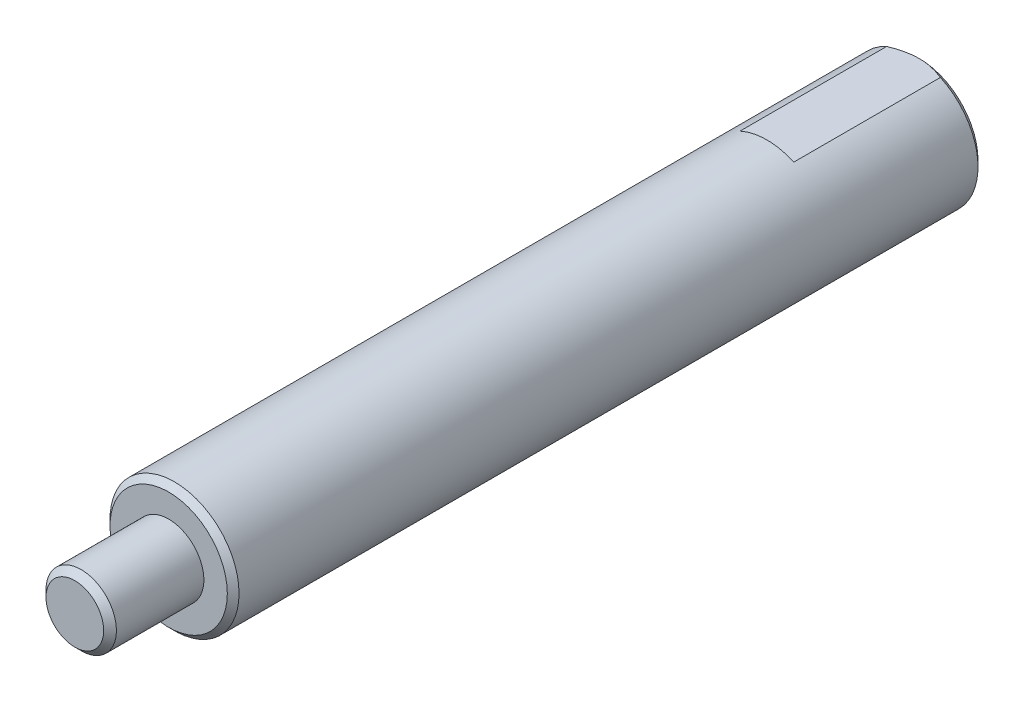
from build123d import *

# Parameters (mm, degrees)
SKETCH_1_R             = 5.5
EXTRUDE_1_DEPTH        = 64
CHAMFER_1_SIZE         = 0.5
SKETCH_2_R             = 3.3
EXTRUDE_2_DEPTH        = 8
HOLE_WIZARD_M5_1_D     = 4.2
HOLE_WIZARD_M5_1_DEPTH = 12.4
HOLE_WIZARD_M5_1_TIP   = 1.2618073
CHAMFER_3_SIZE         = 0.5
SKETCH_6_W             = 10
SKETCH_6_H             = 3
CUT_EXTRUDE_1_DEPTH    = 13


# Read off the part's stored shape, not the designer's step: M6 机械螺纹 螺柱1
with BuildPart() as part:
    # 草图1 → 拉伸1 (new body)
    with BuildSketch(Plane.XY):
        Circle(SKETCH_1_R)
    extrude(amount=EXTRUDE_1_DEPTH)

    # 倒角1
    chamfer_1_edges = [part.edges().sort_by_distance(p)[0] for p in [
        (-5.5, 0, 0),
        (-5.5, 0, 64),
    ]]
    chamfer(chamfer_1_edges, length=CHAMFER_1_SIZE)

    # 草图2 → 拉伸2 (add)
    with BuildSketch(Plane.XY.offset(64)):
        Circle(SKETCH_2_R)
    extrude(amount=EXTRUDE_2_DEPTH)

    # M5 螺纹孔1
    with Locations(Plane(origin=(0, 0, 0), x_dir=(-1, 0, 0), z_dir=(0, 0, -1))):
        with Locations((0, 0)):
            Hole(HOLE_WIZARD_M5_1_D / 2, depth=HOLE_WIZARD_M5_1_DEPTH)
            with Locations((0, 0, -(HOLE_WIZARD_M5_1_DEPTH + HOLE_WIZARD_M5_1_TIP / 2))):  # 118° drill point
                Cone(0, HOLE_WIZARD_M5_1_D / 2, HOLE_WIZARD_M5_1_TIP, mode=Mode.SUBTRACT)

    # 倒角3
    chamfer_3_edges = [part.edges().sort_by_distance(p)[0] for p in [
        (-2.1, 0, 0),
    ]]
    chamfer(chamfer_3_edges, length=CHAMFER_3_SIZE)

    # 草图6 → 切除-拉伸1 (cut)
    with BuildSketch(Plane(origin=(0, 0, 0), x_dir=(-1, 0, 0), z_dir=(0, 0, -1))):
        with Locations((0, 6.5)):
            Rectangle(SKETCH_6_W, SKETCH_6_H)
        with Locations((0, -6.5)):
            Rectangle(SKETCH_6_W, SKETCH_6_H)
    extrude(amount=-CUT_EXTRUDE_1_DEPTH, mode=Mode.SUBTRACT)

    # M6 机械螺纹 螺柱1 outline → M6 机械螺纹 螺柱1 (revolve, cut)
    with BuildSketch(Plane.XZ):
        Polygon((3.3, 72), (2.4585, 72), (3, 71.4585), (3, 64), (3.3, 64), align=None)
    revolve(axis=Axis((0, 0, 0), (0, 0, 1)), mode=Mode.SUBTRACT)


solid = part.part
